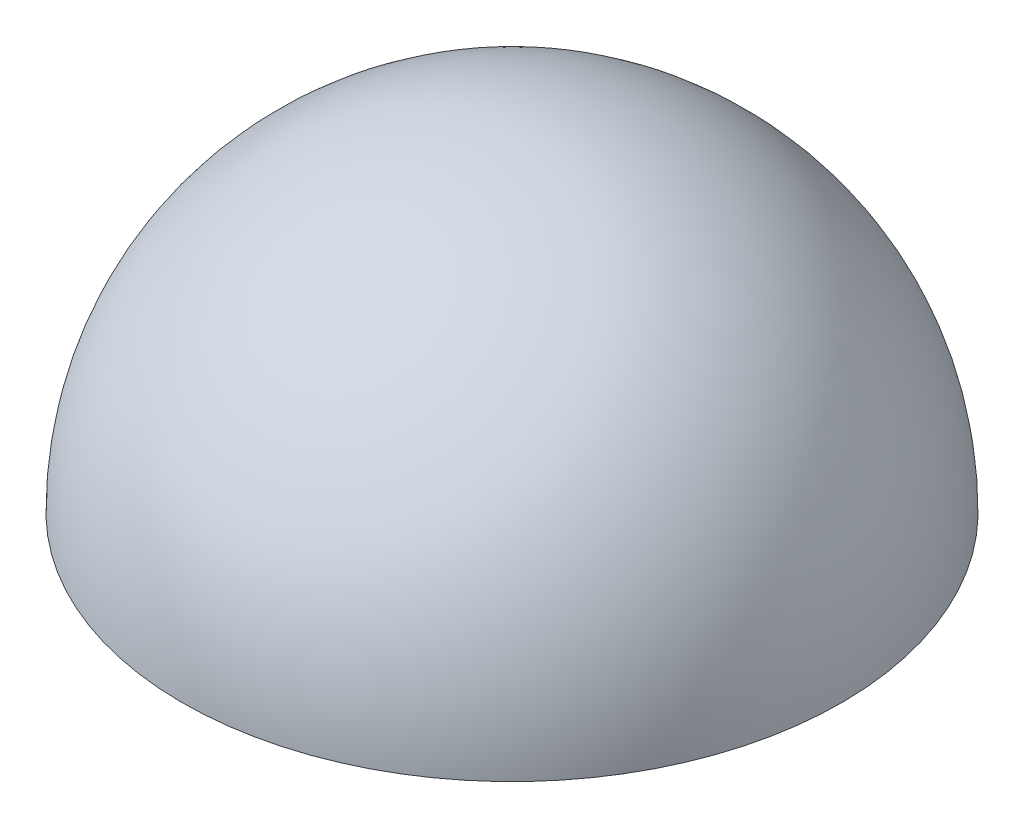
from build123d import *

# Parameters (mm, degrees)
REVOLVE1_ANGLE = 180


with BuildPart() as part:
    # Sketch1 → Revolve1 (revolve)
    with BuildSketch(Plane(origin=(0, 0, 0), x_dir=(1, 0, 0), z_dir=(0, 1, 0))):
        with BuildLine():
            Line((-24.076354167, -62.120927157), (-33.588943128, 83.618954657))
            ThreePointArc((-33.588943128, 83.618954657), (-101.702589555, 5.99271927), (-24.076354167, -62.120927157))
        make_face()
    revolve(axis=Axis((-33.588943128, 0, -83.618954657), (-0.06513241329109924, 0, -0.9978766300194015)), revolution_arc=REVOLVE1_ANGLE)


solid = part.part
